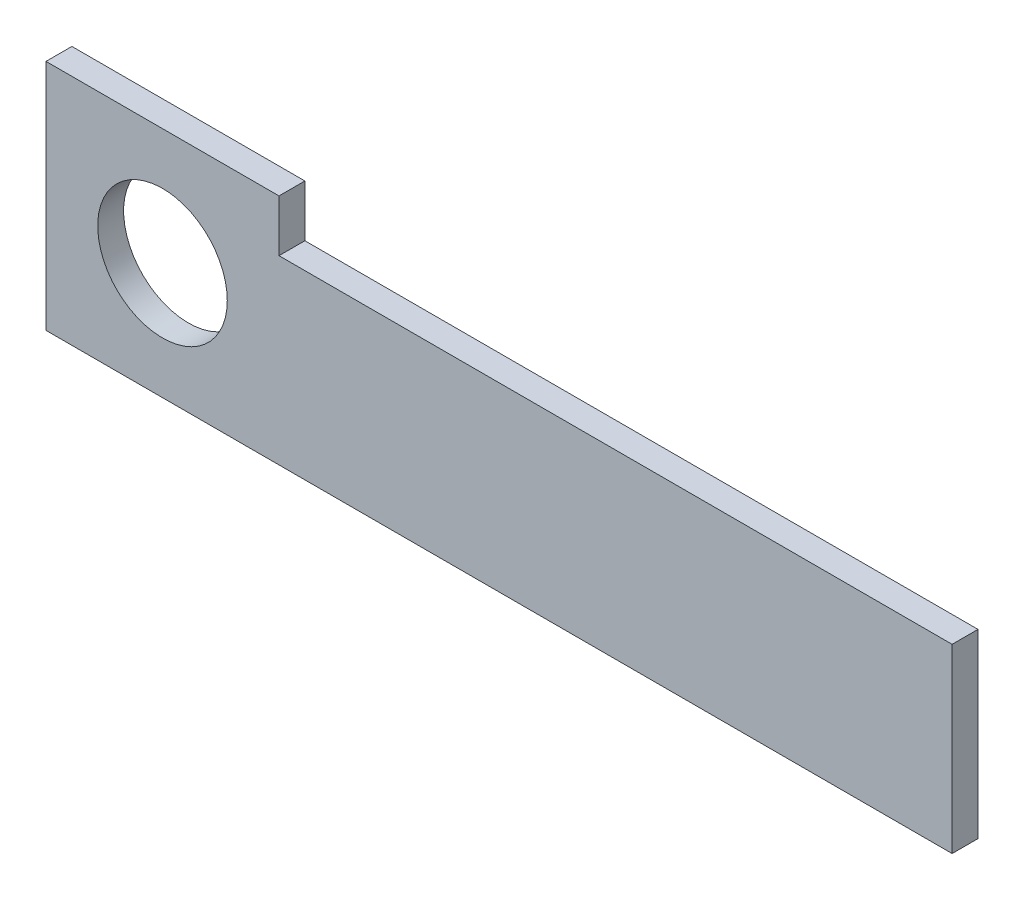
from build123d import *

# Parameters (mm, degrees)
BOSS_EXTRUDE1_DEPTH = 10
SKETCH2_R           = 25.025
CUT_EXTRUDE1_DEPTH  = 501.838002422


with BuildPart() as part:
    # Sketch1 → Boss-Extrude1 (new body)
    with BuildSketch(Plane.XY):
        Polygon((-20.300605602, -267.069972203), (-280.300605602, -267.069972203), (-280.300605602, -247.069972203), (-370.300605602, -247.069972203), (-370.300605602, -267.069972203), (-370.300605602, -337.069972203), (-20.300605602, -337.069972203), align=None)
    extrude(amount=BOSS_EXTRUDE1_DEPTH)

    # Sketch2 → Cut-Extrude1 (cut, through all)
    with BuildSketch(Plane.XY.offset(10)):
        with Locations((-325.300605602, -292.069972203)):
            Circle(SKETCH2_R)
    extrude(amount=-CUT_EXTRUDE1_DEPTH, mode=Mode.SUBTRACT)


solid = part.part
